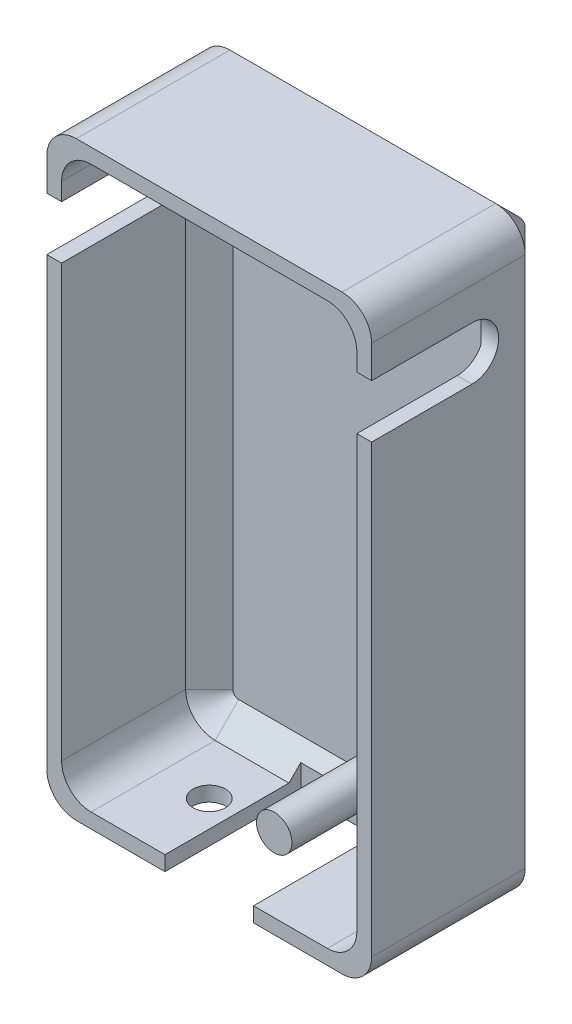
from build123d import *

# Parameters (mm, degrees)
SKETCH_1_W          = 55
SKETCH_1_H          = 100
EXTRUDE_1_DEPTH     = 30
CUT_EXTRUDE_1_DEPTH = 81.156097709
SKETCH_3_W          = 50
SKETCH_3_H          = 95
CUT_EXTRUDE_2_DEPTH = 25
FILLET_1_R          = 5
SKETCH_5_R          = 3
EXTRUDE_2_DEPTH     = 25
SKETCH_6_W          = 15
SKETCH_6_H          = 23
CUT_EXTRUDE_4_DEPTH = 5
CHAMFER_1_SIZE      = 4
SKETCH_7_R          = 5
EXTRUDE_3_DEPTH     = 5
SKETCH_8_R          = 2.75
CUT_EXTRUDE_5_DEPTH = 5


with BuildPart() as part:
    # 草圖1 → 填料-伸長1 (new body)
    with BuildSketch(Plane.XY):
        Rectangle(SKETCH_1_W, SKETCH_1_H)
    extrude(amount=EXTRUDE_1_DEPTH)

    # 草圖2 → 除料-伸長1 (cut, through all)
    with BuildSketch(Plane.ZY.offset(27.5)):
        with BuildLine():
            Line((13, 39.5), (30, 39.5))
            Line((30, 39.5), (30, 30.5))
            Line((30, 30.5), (13, 30.5))
            ThreePointArc((13, 30.5), (8.5, 35), (13, 39.5))
        make_face()
    extrude(amount=-CUT_EXTRUDE_1_DEPTH, mode=Mode.SUBTRACT)

    # 草圖3 → 除料-伸長2 (cut)
    with BuildSketch(Plane.XY.offset(30)):
        Rectangle(SKETCH_3_W, SKETCH_3_H)
    extrude(amount=-CUT_EXTRUDE_2_DEPTH, mode=Mode.SUBTRACT)

    # 圓角1
    fillet_1_edges = [part.edges().sort_by_distance(p)[0] for p in [
        (25, 47.5, 17.5),
        (-25, -47.5, 17.5),
        (25, -47.5, 17.5),
        (-25, 47.5, 17.5),
        (27.5, -50, 15),
        (-27.5, -50, 15),
        (-27.5, 50, 15),
        (27.5, 50, 15),
    ]]
    fillet(fillet_1_edges, radius=FILLET_1_R)

    # 草圖5 → 填料-伸長2 (add)
    with BuildSketch(Plane.XY.offset(5)):
        with Locations(Location((11, -35, 0), (0, 0, 180))):
            Circle(SKETCH_5_R)
    extrude(amount=EXTRUDE_2_DEPTH)

    # 草圖6 → 除料-伸長4 (cut)
    with BuildSketch(Plane.XZ.offset(50)):
        with Locations((0, 18.5)):
            Rectangle(SKETCH_6_W, SKETCH_6_H)
    extrude(amount=-CUT_EXTRUDE_4_DEPTH, mode=Mode.SUBTRACT)

    # 導角1
    # the kernel refuses this chamfer: 4 mm, written as the material it adds along each edge
    with BuildSketch(Plane(origin=(-20, -42.5, 5), x_dir=(-1, 0, 0), z_dir=(0, 1, 0))) as chamfer_1_piece_1:
        Polygon((5, CHAMFER_1_SIZE), (5 - CHAMFER_1_SIZE, 0), (5, 0), align=None)
    revolve(axis=Axis((-20, -42.5, 5), (0, 0, 1)), revolution_arc=90)
    with BuildSketch(Plane(origin=(-25, 42.5, 5), x_dir=(-0.027495876610586487, 0, 0.9996219169112968), z_dir=(0, -1, 0))) as chamfer_1_piece_2_section:
        Polygon((CHAMFER_1_SIZE * 0.999621916911, -CHAMFER_1_SIZE * 0.0274958766106), (-CHAMFER_1_SIZE * 0.0274958766106, -CHAMFER_1_SIZE * 0.999621916911), (0, 0), align=None)
    chamfer_1_piece_2 = extrude(amount=85, mode=Mode.PRIVATE)
    chamfer_1_piece_2 = chamfer_1_piece_2 - Plane(origin=(-23.679821879, 35, 13), x_dir=(0, -1, 0), z_dir=(-1, 0, 0)) * Cylinder(4.5, 186, mode=Mode.PRIVATE)
    add(chamfer_1_piece_2)
    with BuildSketch(Plane(origin=(-20, 42.5, 5), x_dir=(-1, 0, 0), z_dir=(0, -1, 0))) as chamfer_1_piece_3:
        Polygon((5 - CHAMFER_1_SIZE, 0), (5, -CHAMFER_1_SIZE), (5, 0), align=None)
    revolve(axis=Axis((-20, 42.5, 5), (0, 0, -1)), revolution_arc=90)
    with BuildSketch(Plane(origin=(20, 47.5, 5), x_dir=(0, -0.9996219169112968, -0.027495876610586296), z_dir=(-1, 0, 0))) as chamfer_1_piece_4:
        Polygon((CHAMFER_1_SIZE * 0.999621916911, CHAMFER_1_SIZE * 0.0274958766106), (-CHAMFER_1_SIZE * 0.0274958766106, CHAMFER_1_SIZE * 0.999621916911), (0, 0), align=None)
    extrude(amount=40)
    with BuildSketch(Plane(origin=(20, 42.5, 5), x_dir=(1, 0, 0), z_dir=(0, -1, 0))) as chamfer_1_piece_5:
        Polygon((5 - CHAMFER_1_SIZE, 0), (5, CHAMFER_1_SIZE), (5, 0), align=None)
    revolve(axis=Axis((20, 42.5, 5), (0, 0, 1)), revolution_arc=90)
    with BuildSketch(Plane(origin=(25, -42.5, 5), x_dir=(0.027495876610586487, 0, 0.9996219169112968), z_dir=(0, 1, 0))) as chamfer_1_piece_6_section:
        Polygon((CHAMFER_1_SIZE * 0.999621916911, -CHAMFER_1_SIZE * 0.0274958766106), (-CHAMFER_1_SIZE * 0.0274958766106, -CHAMFER_1_SIZE * 0.999621916911), (0, 0), align=None)
    chamfer_1_piece_6 = extrude(amount=85, mode=Mode.PRIVATE)
    chamfer_1_piece_6 = chamfer_1_piece_6 - Plane(origin=(23.679821879, 35, 13), x_dir=(0, -1, 0), z_dir=(-1, 0, 0)) * Cylinder(4.5, 186, mode=Mode.PRIVATE)
    add(chamfer_1_piece_6)
    with BuildSketch(Plane(origin=(20, -42.5, 5), x_dir=(0, -1, 0), z_dir=(-1, 0, 0))) as chamfer_1_piece_7:
        Polygon((5, CHAMFER_1_SIZE), (5 - CHAMFER_1_SIZE, 0), (5, 0), align=None)
    revolve(axis=Axis((20, -42.5, 5), (0, 0, 1)), revolution_arc=90)
    with BuildSketch(Plane(origin=(-20, -47.5, 5), x_dir=(0, -0.027495876610585623, 0.9996219169112968), z_dir=(1, 0, 0))) as chamfer_1_piece_8_section:
        Polygon((CHAMFER_1_SIZE * 0.999621916911, -CHAMFER_1_SIZE * 0.0274958766106), (-CHAMFER_1_SIZE * 0.0274958766106, -CHAMFER_1_SIZE * 0.999621916911), (0, 0), align=None)
    chamfer_1_piece_8 = extrude(amount=40, mode=Mode.PRIVATE)
    chamfer_1_piece_8 = split(chamfer_1_piece_8, bisect_by=Plane(origin=(-13.75, -46.917717373, 7), z_dir=(0, 0, 1)), keep=Keep.TOP, mode=Mode.PRIVATE)
    chamfer_1_piece_8 = split(chamfer_1_piece_8, bisect_by=Plane(origin=(-7.5, -46.917717373, 7.727438446), z_dir=(-1, 0, 0)), keep=Keep.TOP, mode=Mode.PRIVATE)
    add(chamfer_1_piece_8)
    with BuildSketch(Plane(origin=(-20, -47.5, 5), x_dir=(0, -0.027495876610585623, 0.9996219169112968), z_dir=(1, 0, 0))) as chamfer_1_piece_9_section:
        Polygon((CHAMFER_1_SIZE * 0.999621916911, -CHAMFER_1_SIZE * 0.0274958766106), (-CHAMFER_1_SIZE * 0.0274958766106, -CHAMFER_1_SIZE * 0.999621916911), (0, 0), align=None)
    chamfer_1_piece_9 = extrude(amount=40, mode=Mode.PRIVATE)
    chamfer_1_piece_9 = split(chamfer_1_piece_9, bisect_by=Plane(origin=(-13.75, -45.926395663, 7), z_dir=(0, 0, -1)), keep=Keep.TOP, mode=Mode.PRIVATE)
    chamfer_1_piece_9 = split(chamfer_1_piece_9, bisect_by=Plane(origin=(-7.5, -45.926395663, 5.832937159), z_dir=(-1, 0, 0)), keep=Keep.TOP, mode=Mode.PRIVATE)
    add(chamfer_1_piece_9)
    with BuildSketch(Plane(origin=(-20, -47.5, 5), x_dir=(0, -0.027495876610585623, 0.9996219169112968), z_dir=(1, 0, 0))) as chamfer_1_piece_10_section:
        Polygon((CHAMFER_1_SIZE * 0.999621916911, -CHAMFER_1_SIZE * 0.0274958766106), (-CHAMFER_1_SIZE * 0.0274958766106, -CHAMFER_1_SIZE * 0.999621916911), (0, 0), align=None)
    chamfer_1_piece_10 = extrude(amount=40, mode=Mode.PRIVATE)
    chamfer_1_piece_10 = split(chamfer_1_piece_10, bisect_by=Plane(origin=(7.5, -45.926395663, 5.832937159), z_dir=(-1, 0, 0)), keep=Keep.TOP, mode=Mode.PRIVATE)
    chamfer_1_piece_10 = split(chamfer_1_piece_10, bisect_by=Plane(origin=(0, -45.926395663, 7), z_dir=(0, 0, -1)), keep=Keep.TOP, mode=Mode.PRIVATE)
    chamfer_1_piece_10 = split(chamfer_1_piece_10, bisect_by=Plane(origin=(-7.5, -45.926395663, 5.832937159), z_dir=(1, 0, 0)), keep=Keep.TOP, mode=Mode.PRIVATE)
    add(chamfer_1_piece_10)
    with BuildSketch(Plane(origin=(-20, -47.5, 5), x_dir=(0, -0.027495876610585623, 0.9996219169112968), z_dir=(1, 0, 0))) as chamfer_1_piece_11_section:
        Polygon((CHAMFER_1_SIZE * 0.999621916911, -CHAMFER_1_SIZE * 0.0274958766106), (-CHAMFER_1_SIZE * 0.0274958766106, -CHAMFER_1_SIZE * 0.999621916911), (0, 0), align=None)
    chamfer_1_piece_11 = extrude(amount=40, mode=Mode.PRIVATE)
    chamfer_1_piece_11 = split(chamfer_1_piece_11, bisect_by=Plane(origin=(7.5, -46.917717373, 7.727438446), z_dir=(1, 0, 0)), keep=Keep.TOP, mode=Mode.PRIVATE)
    chamfer_1_piece_11 = split(chamfer_1_piece_11, bisect_by=Plane(origin=(13.75, -46.917717373, 7), z_dir=(0, 0, 1)), keep=Keep.TOP, mode=Mode.PRIVATE)
    add(chamfer_1_piece_11)
    with BuildSketch(Plane(origin=(-20, -47.5, 5), x_dir=(0, -0.027495876610585623, 0.9996219169112968), z_dir=(1, 0, 0))) as chamfer_1_piece_12_section:
        Polygon((CHAMFER_1_SIZE * 0.999621916911, -CHAMFER_1_SIZE * 0.0274958766106), (-CHAMFER_1_SIZE * 0.0274958766106, -CHAMFER_1_SIZE * 0.999621916911), (0, 0), align=None)
    chamfer_1_piece_12 = extrude(amount=40, mode=Mode.PRIVATE)
    chamfer_1_piece_12 = split(chamfer_1_piece_12, bisect_by=Plane(origin=(7.5, -45.926395663, 5.832937159), z_dir=(1, 0, 0)), keep=Keep.TOP, mode=Mode.PRIVATE)
    chamfer_1_piece_12 = split(chamfer_1_piece_12, bisect_by=Plane(origin=(13.75, -45.926395663, 7), z_dir=(0, 0, -1)), keep=Keep.TOP, mode=Mode.PRIVATE)
    add(chamfer_1_piece_12)
    # the kernel refuses this chamfer: 4 mm, written as the material it takes off along each edge
    with BuildSketch(Plane(origin=(-27.5, 45, 0), x_dir=(-0.027495876610586494, 0, 0.9996219169112968), z_dir=(0, -1, 0)), Plane(origin=(27.5, -45, 0), x_dir=(0.027495876610586494, 0, 0.9996219169112968), z_dir=(0, 1, 0))) as chamfer_1_2_piece_1:
        Polygon((CHAMFER_1_SIZE * 0.999621916911, -CHAMFER_1_SIZE * 0.0274958766106), (-CHAMFER_1_SIZE * 0.0274958766106, -CHAMFER_1_SIZE * 0.999621916911), (0, 0), align=None)
    extrude(amount=90, mode=Mode.SUBTRACT)
    with BuildSketch(Plane(origin=(-22.5, -45, 0), x_dir=(0, -1, 0), z_dir=(1, 0, 0))) as chamfer_1_2_piece_2:
        Polygon((5, -CHAMFER_1_SIZE), (5 - CHAMFER_1_SIZE, 0), (5, 0), align=None)
    revolve(axis=Axis((-22.5, -45, 0), (0, 0, -1)), revolution_arc=90, mode=Mode.SUBTRACT)
    with BuildSketch(Plane(origin=(-22.5, 45, 0), x_dir=(-1, 0, 0), z_dir=(0, -1, 0))) as chamfer_1_2_piece_3:
        Polygon((5, -CHAMFER_1_SIZE), (5 - CHAMFER_1_SIZE, 0), (5, 0), align=None)
    revolve(axis=Axis((-22.5, 45, 0), (0, 0, -1)), revolution_arc=90, mode=Mode.SUBTRACT)
    with BuildSketch(Plane(origin=(-22.5, -50, 0), x_dir=(0, -0.02749587661058563, 0.9996219169112968), z_dir=(1, 0, 0)), Plane(origin=(22.5, 50, 0), x_dir=(0, 0.02749587661058563, 0.9996219169112968), z_dir=(-1, 0, 0))) as chamfer_1_2_piece_4:
        Polygon((CHAMFER_1_SIZE * 0.999621916911, -CHAMFER_1_SIZE * 0.0274958766106), (-CHAMFER_1_SIZE * 0.0274958766106, -CHAMFER_1_SIZE * 0.999621916911), (0, 0), align=None)
    extrude(amount=45, mode=Mode.SUBTRACT)
    with BuildSketch(Plane(origin=(22.5, -45, 0), x_dir=(0, -1, 0), z_dir=(-1, 0, 0))) as chamfer_1_2_piece_5:
        Polygon((5, CHAMFER_1_SIZE), (5 - CHAMFER_1_SIZE, 0), (5, 0), align=None)
    revolve(axis=Axis((22.5, -45, 0), (0, 0, 1)), revolution_arc=90, mode=Mode.SUBTRACT)
    with BuildSketch(Plane(origin=(22.5, 45, 0), x_dir=(1, 0, 0), z_dir=(0, -1, 0))) as chamfer_1_2_piece_6:
        Polygon((5, CHAMFER_1_SIZE), (5 - CHAMFER_1_SIZE, 0), (5, 0), align=None)
    revolve(axis=Axis((22.5, 45, 0), (0, 0, 1)), revolution_arc=90, mode=Mode.SUBTRACT)

    # 草圖7 → 填料-伸長3 (add)
    with BuildSketch(Plane.XY.offset(5)):
        with Locations(Location((11, -35, 0), (0, 0, 180))):
            Circle(SKETCH_7_R)
    extrude(amount=EXTRUDE_3_DEPTH)

    # 草圖8 → 除料-伸長5 (cut)
    with BuildSketch(Plane.XZ.offset(50)):
        with Locations(Location((-12, 18, 0), (0, 0, 270))):
            Circle(SKETCH_8_R)
    extrude(amount=-CUT_EXTRUDE_5_DEPTH, mode=Mode.SUBTRACT)


solid = part.part
